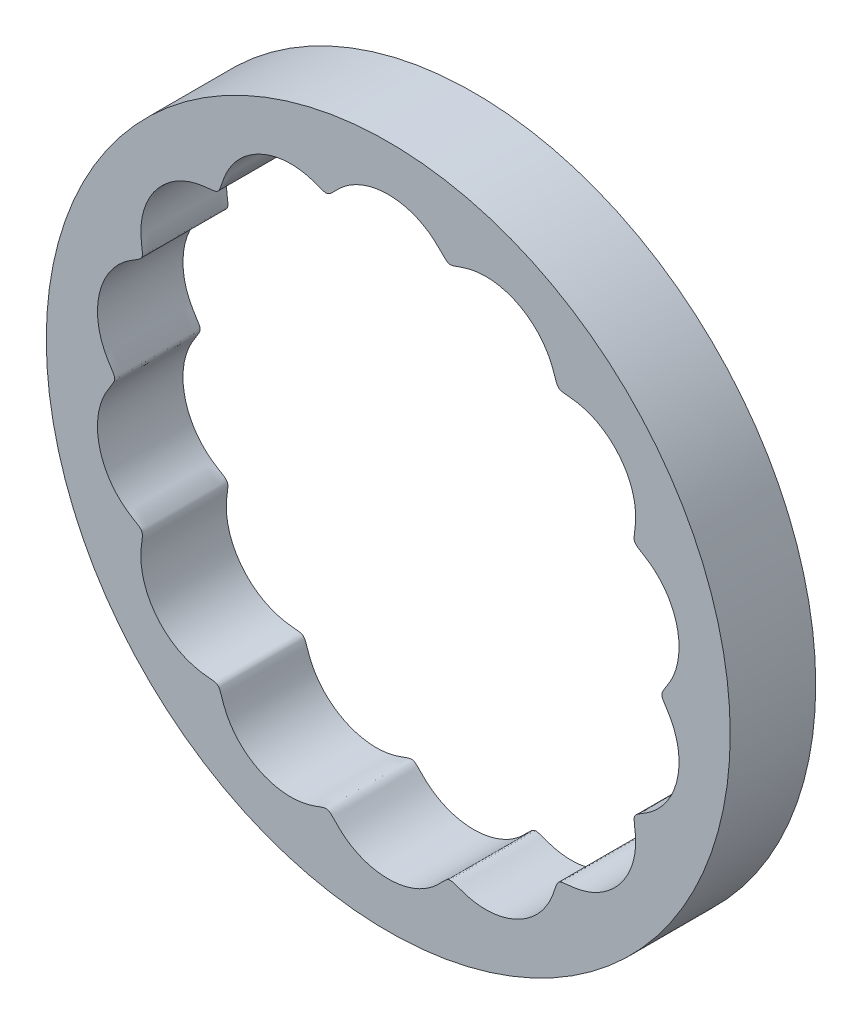
from build123d import *

# Parameters (mm, degrees)
SKIZZE4_R                       = 60
AUFSATZ_LINEAR_AUSTRAGEN2_DEPTH = 15
SCHNITT_LINEAR_START            = -15
SCHNITT_LINEAR_AUSTRAGEN3_DEPTH = 15


# Read off the part's stored shape, not the designer's step: Schnitt-Linear austragen3
with BuildPart() as part:
    # Skizze4 → Aufsatz-Linear austragen2 (new body)
    with BuildSketch(Plane.XY):
        Circle(SKIZZE4_R)
    extrude(amount=AUFSATZ_LINEAR_AUSTRAGEN2_DEPTH)

    # Schnitt-Linear austragen3 outline → Schnitt-Linear austragen3 (cut)
    with BuildSketch(Plane.XY.offset(15).offset(SCHNITT_LINEAR_START)):
        with BuildLine():
            Line((48.000019739, -0.006283221), (48, 0))
            add(Edge.make_bspline(
                [(48, 0), (48, 0.013397975), (48.000682338, 0.040193018), (48.003752861, 0.089861091), (48.011806345, 0.159279078), (48.024569669, 0.228978023), (48.042744168, 0.300213423), (48.066800259, 0.37644152), (48.096927486, 0.456815649), (48.131896774, 0.538249592), (48.171371314, 0.620848577), (48.226221036, 0.7264553), (48.298423731, 0.853853244), (48.387172592, 0.999788349), (48.49672569, 1.171693609), (48.612958824, 1.349561216), (48.765914004, 1.582406851), (49.016668959, 1.967532696), (49.348930943, 2.505592153), (49.734855147, 3.212657688), (50.21109895, 4.260430529), (50.653658871, 5.570588494), (50.97396859, 7.154192421), (51.069497394, 8.997743353), (50.893209875, 10.882054002), (50.428714029, 12.765786136), (49.663368839, 14.599986613), (48.724030109, 16.112324108), (47.750785111, 17.284441663), (46.837817159, 18.163695052), (46.05143991, 18.804052245), (45.29909968, 19.323229984), (44.669726019, 19.706669833), (44.188132694, 19.992826394), (43.84195236, 20.21229431), (43.577709803, 20.403725858), (43.354217171, 20.620649207), (43.204374171, 20.885435379), (43.142664238, 21.137191453), (43.127015364, 21.382644895), (43.137959231, 21.672623475), (43.171553441, 21.99540685), (43.233851036, 22.463187336), (43.320305798, 23.111493464), (43.394092056, 23.900468966), (43.423424633, 25.07228213), (43.308322183, 26.518248625), (42.950764896, 28.175342706), (42.253359763, 29.982426819), (41.297039558, 31.649368485), (40.113072187, 33.143670536), (38.733369095, 34.437161716), (37.190503467, 35.505182846), (35.715186602, 36.226818089), (34.383789441, 36.677245734), (33.25144098, 36.935638694), (32.343166525, 37.075064756), (31.588729427, 37.147152633), (30.993460176, 37.196487712), (30.548155026, 37.263452752), (30.266314899, 37.333650225), (30.002171553, 37.453143261), (29.761175185, 37.664272777), (29.594305317, 37.934490998), (29.46572193, 38.233501751), (29.328583395, 38.618587397), (29.157101503, 39.150379453), (28.924478925, 39.847684759), (28.587702733, 40.694964926), (28.141036741, 41.602542545), (27.490722326, 42.686717201), (26.56959106, 43.895240183), (25.310570362, 45.147441447), (23.698262949, 46.304650312), (21.967971124, 47.181715149), (20.169797777, 47.778667956), (18.347431505, 48.101340513), (16.496972871, 48.151214964), (14.889437733, 47.950271244), (13.547255755, 47.604901196), (12.584808997, 47.265977648), (11.972206779, 47.030394008), (11.488068995, 46.863581463), (11.152517418, 46.778239888), (10.838609451, 46.756848467), (10.584646695, 46.811853453), (10.390870107, 46.903359364), (10.184596428, 47.039174076), (9.970354387, 47.22036973), (9.637865551, 47.547815603), (9.190368883, 48.023564371), (8.475401192, 48.744172241), (7.424025544, 49.63643012), (6.0731032, 50.515688078), (4.396097342, 51.277389513), (2.625650516, 51.783927308), (0.752285771, 52.036532897), (-1.187991503, 52.008549737), (-3.150272992, 51.675688373), (-5.080855284, 51.01662287), (-6.653101107, 50.17053533), (-7.780758488, 49.340796732), (-8.539177946, 48.664705273), (-9.012544219, 48.202263186), (-9.349663885, 47.853824951), (-9.649493385, 47.538731986), (-9.904251266, 47.285290369), (-10.094772111, 47.113001127), (-10.29418801, 46.961345264), (-10.496144868, 46.845219657), (-10.736964097, 46.770376008), (-10.995895116, 46.76350349), (-11.238297143, 46.801331369), (-11.518104219, 46.875196549), (-11.824695224, 46.979019694), (-12.265846692, 47.143189958), (-12.876970246, 47.371513038), (-13.627564611, 47.619243221), (-14.760155649, 47.909605828), (-16.191461628, 48.121307748), (-17.882207817, 48.145101579), (-19.795023346, 47.872835715), (-21.621144942, 47.320723315), (-23.323942252, 46.516037891), (-24.871716392, 45.486795401), (-26.237906751, 44.261637009), (-27.409813058, 42.84903371), (-28.238829154, 41.473346413), (-28.794344681, 40.216554108), (-29.123329932, 39.260065951), (-29.304904145, 38.685750068), (-29.446338705, 38.287624028), (-29.554146684, 38.030033963), (-29.666783938, 37.811509325), (-29.827344734, 37.593892418), (-30.088924926, 37.400468667), (-30.386822201, 37.296288336), (-30.705884761, 37.236519548), (-31.11068587, 37.187960387), (-31.66584026, 37.139142493), (-32.395611729, 37.068252497), (-33.294452723, 36.929998928), (-34.276544469, 36.698703087), (-35.475875234, 36.309238549), (-36.856836062, 35.684758035), (-38.356223562, 34.74213152), (-39.844788539, 33.433849179), (-41.08910742, 31.946032825), (-42.077029781, 30.326733182), (-42.803276004, 28.619469977), (-43.268854395, 26.823058602), (-43.434139422, 25.207371679), (-43.398152576, 23.818449427), (-43.282549676, 22.802019897), (-43.189080543, 22.150700659), (-43.133224528, 21.640377637), (-43.123321644, 21.293474822), (-43.16974963, 20.981925834), (-43.295025506, 20.705911572), (-43.468075657, 20.505995665), (-43.656681572, 20.347857209), (-43.884196177, 20.185524348), (-44.241393478, 19.959060188), (-44.761382203, 19.653910853), (-45.621375369, 19.119494043), (-46.72363573, 18.296757221), (-47.880685076, 17.180434204), (-48.996911667, 15.721150234), (-49.886618818, 14.114115711), (-50.543988904, 12.374550115), (-50.947446592, 10.53495434), (-51.077143638, 8.632630115), (-50.935472445, 6.949665915), (-50.629155813, 5.537048557), (-50.252104579, 4.394809334), (-49.879164885, 3.507797549), (-49.45423872, 2.683333462), (-49.045759979, 2.007579161), (-48.687437752, 1.463177714), (-48.429542721, 1.069975342), (-48.260465584, 0.794325337), (-48.126724034, 0.538050561), (-48.036563121, 0.31012529), (-47.986677164, 0.056059596), (-48.007172496, -0.195270135), (-48.076180614, -0.417906825), (-48.180223864, -0.646088731), (-48.306190667, -0.870261042), (-48.49696051, -1.175239643), (-48.737696715, -1.538019056), (-49.002559458, -1.944690147), (-49.348191756, -2.509791901), (-49.83857168, -3.40079036), (-50.39625337, -4.686491984), (-50.870323053, -6.409723175), (-51.081515023, -8.440821646), (-50.967108293, -10.428950866), (-50.56040692, -12.32645995), (-49.895574265, -14.095087862), (-49.007034118, -15.705971706), (-47.891066483, -17.168988568), (-46.733568043, -18.288444965), (-45.630309557, -19.113370926), (-44.769374403, -19.649301591), (-44.206465825, -19.979198909), (-43.778008931, -20.253731092), (-43.505534784, -20.464464649), (-43.298713925, -20.700194311), (-43.17158236, -20.975499471), (-43.123550105, -21.286464526), (-43.132657239, -21.632983682), (-43.187913287, -22.142517074), (-43.281331462, -22.792866338), (-43.397329168, -23.807636287), (-43.434575475, -25.194418518), (-43.271406309, -26.80782339), (-42.808987151, -28.602145517), (-42.086481561, -30.307955973), (-41.102090517, -31.927840567), (-39.860334819, -33.41804662), (-38.372739017, -34.730038362), (-36.872389367, -35.67642592), (-35.490068947, -36.303723843), (-34.289295015, -36.695190111), (-33.305911993, -36.927832605), (-32.405769745, -37.067022596), (-31.674897874, -37.138357777), (-31.118848885, -37.187192734), (-30.713358378, -37.235414267), (-30.393635162, -37.294607309), (-30.093508974, -37.398006171), (-29.834929293, -37.587153328), (-29.660439348, -37.818816428), (-29.529685475, -38.078465297), (-29.365574992, -38.498301964), (-29.184897196, -39.068251679), (-28.946297555, -39.788396882), (-28.607475536, -40.643564788), (-28.102420822, -41.690747796), (-27.365385235, -42.889158649), (-26.331420095, -44.167267894), (-24.944226457, -45.433658962), (-23.374204972, -46.489686931), (-21.652980722, -47.309438578), (-19.815348341, -47.86850352), (-17.900017514, -48.144138604), (-16.206608828, -48.122560134), (-14.772861995, -47.912170967), (-13.638251675, -47.622423232), (-12.886334242, -47.374830016), (-12.274180217, -47.146372952), (-11.832402962, -46.981792836), (-11.525425585, -46.877524286), (-11.245346098, -46.802823675), (-11.002697299, -46.764092435), (-10.743639222, -46.769245619), (-10.452508547, -46.857725744), (-10.191635247, -47.028185572), (-9.94623478, -47.243739487), (-9.655108362, -47.532884133), (-9.268590992, -47.939158712), (-8.754040516, -48.467800585), (-8.079468779, -49.086022928), (-7.27898423, -49.710289952), (-6.217026178, -50.40463165), (-4.855774482, -51.092184509), (-3.170037941, -51.670414657), (-1.210077502, -52.006410224), (0.729984365, -52.03786949), (2.605089057, -51.788383268), (4.379025627, -51.283823954), (6.059633456, -50.52325974), (7.413660625, -49.644212045), (8.467492409, -48.751568536), (9.183988355, -48.030237671), (9.632199053, -47.553795253), (9.964868632, -47.225505761), (10.179003683, -47.043525423), (10.385020564, -46.906671566), (10.578389737, -46.814010081), (10.831887239, -46.757233446), (11.145663641, -46.776974535), (11.480962383, -46.861383056), (11.964507685, -47.027453664), (12.576154615, -47.262742166), (13.536911672, -47.601684742), (14.876716886, -47.947789755), (16.481557752, -48.15028264), (18.329265708, -48.103009194), (20.14937397, -47.783650386), (21.947320321, -47.190265865), (23.679362283, -46.316238622), (25.295067182, -45.160813387), (26.557971605, -43.908526931), (27.482158709, -42.699315712), (28.134747957, -41.614188535), (28.583025555, -40.705654476), (28.920997845, -39.857321749), (29.154327412, -39.159037503), (29.326001363, -38.626390598), (29.463029448, -38.240544341), (29.591125043, -37.940797644), (29.753557986, -37.675253343), (29.979253756, -37.471281097), (30.211504297, -37.35595363), (30.447712617, -37.286584614), (30.733243533, -37.233085958), (31.055757757, -37.194184657), (31.526151191, -37.150869975), (32.178075313, -37.090690137), (32.964420976, -36.986604862), (34.114375598, -36.753526978), (35.499529553, -36.318101325), (37.036421997, -35.598739615), (38.643538577, -34.514038878), (40.058354358, -33.205547497), (41.254773789, -31.710017311), (42.211033281, -30.063955958), (42.908226903, -28.304785905), (43.278339698, -26.690581501), (43.413505944, -25.279837807), (43.405374974, -24.117647672), (43.334550379, -23.211317406), (43.236922829, -22.476068225), (43.156897436, -21.906777812), (43.126700004, -21.47349397), (43.133736701, -21.192104444), (43.191370257, -20.912388357), (43.344877059, -20.630774098), (43.572259001, -20.408222723), (43.835678594, -20.216480952), (44.181096145, -19.997080761), (44.661900124, -19.711303754), (45.290478322, -19.328774306), (46.042060313, -18.810998378), (46.827866133, -18.172426984), (47.740415213, -17.295604444), (48.713673796, -16.126620224), (49.653800142, -14.618087918), (50.42164489, -12.786800452), (50.889493713, -10.904094178), (51.069205722, -9.01877129), (50.976402592, -7.172277782), (50.657772051, -5.585829471), (50.216107493, -4.273144825), (49.740215201, -3.223286277), (49.354290074, -2.51478659), (49.021841332, -1.975679814), (48.770813325, -1.589874868), (48.617626796, -1.356667022), (48.501173915, -1.178559876), (48.391352209, -1.006468041), (48.302314354, -0.860419741), (48.229793121, -0.73296018), (48.174616291, -0.627318027), (48.13484248, -0.544693574), (48.099533117, -0.463236371), (48.069025007, -0.382830358), (48.044573641, -0.30657908), (48.026000958, -0.235337691), (48.012823642, -0.165638994), (48.004340991, -0.096210489), (48.000955955, -0.046506088), (48.000103994, -0.019693024), (48.000019739, -0.006283221)],
                knots=[0.081127023, 0.081127023, 0.081127023, 0.081127023, 0.081127023, 0.081283215, 0.081439407, 0.081595599, 0.081751791, 0.081960657, 0.082169523, 0.082378389, 0.082587255, 0.082825542, 0.083063829, 0.083540404, 0.084016978, 0.084493553, 0.085054622, 0.085615691, 0.08673783, 0.088982107, 0.091229201, 0.093476294, 0.097967824, 0.102457377, 0.106949645, 0.111441266, 0.116387262, 0.121334109, 0.126278455, 0.128752316, 0.131226176, 0.133698807, 0.136171438, 0.13767167, 0.138421786, 0.139171902, 0.140171161, 0.140859371, 0.141432573, 0.142103567, 0.142679543, 0.14325552, 0.144263787, 0.145272055, 0.147288591, 0.149643412, 0.151998233, 0.156709081, 0.161420027, 0.166130649, 0.170841331, 0.175406193, 0.179971928, 0.184534792, 0.189100319, 0.191383626, 0.193666934, 0.195867402, 0.198067869, 0.198784074, 0.199500278, 0.200261208, 0.200898977, 0.201585911, 0.202582147, 0.203330299, 0.204078451, 0.205574754, 0.208041143, 0.210507531, 0.21297509, 0.215442649, 0.220374031, 0.225308196, 0.230241458, 0.234744294, 0.239247739, 0.24374867, 0.248250944, 0.25275663, 0.25500667, 0.257256711, 0.258212135, 0.25916756, 0.260005663, 0.260631362, 0.261255219, 0.261671627, 0.262088035, 0.263038908, 0.26398978, 0.266228302, 0.268466823, 0.272949502, 0.27743019, 0.281908447, 0.286389535, 0.29086994, 0.295828664, 0.300788186, 0.305745485, 0.310705798, 0.313184671, 0.314424108, 0.315663544, 0.317167709, 0.317919791, 0.318671873, 0.319173009, 0.319674145, 0.32036365, 0.320936237, 0.321604842, 0.322179295, 0.322753749, 0.323759449, 0.324765149, 0.326776549, 0.329125481, 0.331474413, 0.336173451, 0.340872384, 0.345571196, 0.350269998, 0.35473479, 0.359200314, 0.363662839, 0.368128428, 0.372595074, 0.374825599, 0.377056124, 0.378003824, 0.378477675, 0.378951525, 0.379780646, 0.380403267, 0.381088946, 0.382082147, 0.382828338, 0.383574528, 0.385066909, 0.387527055, 0.389987201, 0.392448453, 0.394909706, 0.39982811, 0.404749588, 0.409670114, 0.414184162, 0.41869878, 0.423211163, 0.42772409, 0.432241264, 0.434497074, 0.436752885, 0.437710583, 0.438668281, 0.439509017, 0.440135667, 0.440758632, 0.441588795, 0.442063092, 0.442537389, 0.443485982, 0.445718757, 0.447951531, 0.452422692, 0.456892532, 0.461359487, 0.465829393, 0.47029858, 0.474992729, 0.479686914, 0.484381139, 0.486728344, 0.489075548, 0.491422173, 0.493768797, 0.495778189, 0.496782885, 0.497787581, 0.498361437, 0.498935293, 0.499602959, 0.50017531, 0.500865329, 0.501367053, 0.501868778, 0.502621631, 0.503374484, 0.504880191, 0.50612085, 0.507361509, 0.509842828, 0.514808072, 0.519770441, 0.524734927, 0.529698637, 0.534174647, 0.538651354, 0.543125184, 0.547601622, 0.552079789, 0.554316058, 0.556552327, 0.557502306, 0.558452286, 0.559284064, 0.559907568, 0.560533638, 0.561372774, 0.562329089, 0.563285405, 0.565537705, 0.567790005, 0.572300194, 0.576806642, 0.581312061, 0.585819885, 0.590327114, 0.595255387, 0.600184581, 0.60511088, 0.607575968, 0.610041057, 0.612504999, 0.614968942, 0.616463708, 0.617211091, 0.617958474, 0.618953522, 0.619639962, 0.62027809, 0.621039992, 0.621756877, 0.622473761, 0.624676468, 0.626879176, 0.629164771, 0.631450367, 0.636020346, 0.64058765, 0.645157879, 0.649727247, 0.654433274, 0.659139269, 0.663845509, 0.66855173, 0.670904244, 0.673256757, 0.675271279, 0.67627854, 0.677285801, 0.677861182, 0.678436562, 0.67910662, 0.679679579, 0.680368294, 0.681368735, 0.682119621, 0.682870507, 0.684372279, 0.686847356, 0.689322433, 0.691798761, 0.694275089, 0.699224512, 0.704176326, 0.709127309, 0.713614536, 0.718102424, 0.722587552, 0.727074835, 0.731564514, 0.733806535, 0.736048556, 0.737000813, 0.737953071, 0.738370284, 0.738787498, 0.739411906, 0.740037037, 0.740873536, 0.741827576, 0.742781617, 0.745028152, 0.747274686, 0.75177338, 0.756269155, 0.760763132, 0.765259779, 0.769755795, 0.774696803, 0.779638681, 0.784577949, 0.787049341, 0.789520734, 0.791990919, 0.794461104, 0.795959796, 0.796709142, 0.797458488, 0.798456564, 0.799144272, 0.799717719, 0.800389648, 0.80096622, 0.801542792, 0.802552068, 0.803561343, 0.805579895, 0.807937023, 0.810294151, 0.815009626, 0.819725276, 0.824440527, 0.829155864, 0.833758725, 0.838361348, 0.84296465, 0.847567603, 0.849868587, 0.85216957, 0.854304626, 0.856439682, 0.857111674, 0.857783666, 0.858542277, 0.859183794, 0.859871226, 0.860868647, 0.861617568, 0.862366489, 0.863864332, 0.866333166, 0.868802, 0.871272029, 0.873742058, 0.87867852, 0.883617655, 0.888555907, 0.893054349, 0.897553415, 0.902049855, 0.906547954, 0.908798545, 0.911049136, 0.913296918, 0.914420809, 0.914982754, 0.915544699, 0.916021966, 0.916499232, 0.916976499, 0.917215132, 0.917453765, 0.917663033, 0.9178723, 0.918081568, 0.918290836, 0.918447169, 0.918603502, 0.918759834, 0.918916167, 0.918916167, 0.918916167, 0.918916167, 0.918916167], degree=4))
        make_face()
    extrude(amount=SCHNITT_LINEAR_AUSTRAGEN3_DEPTH, mode=Mode.SUBTRACT)


solid = part.part
